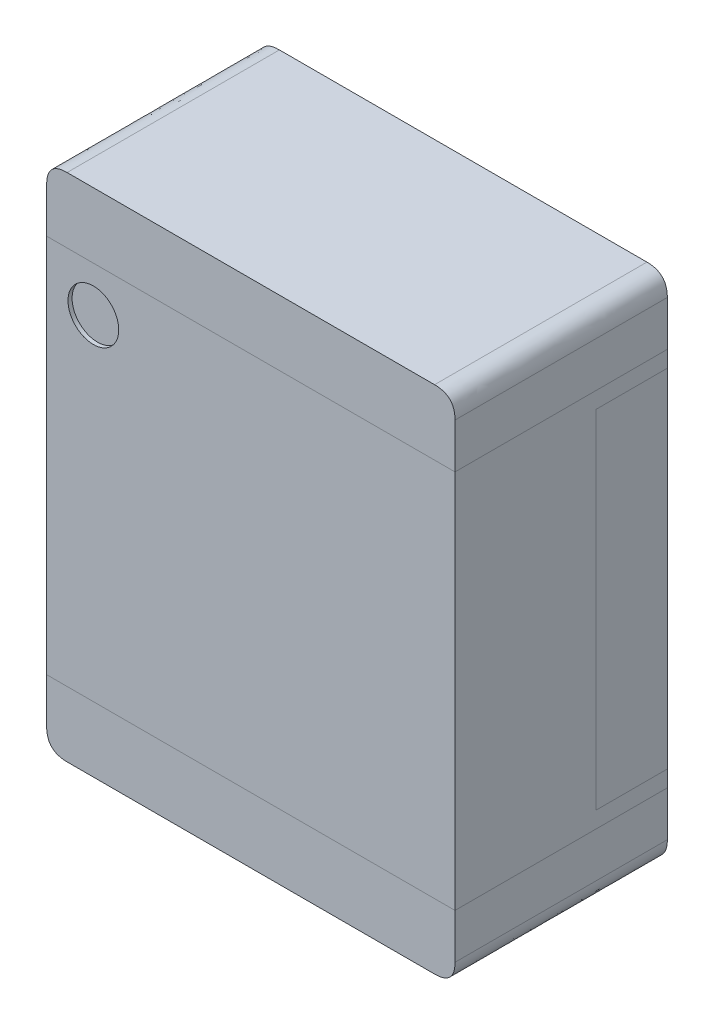
from build123d import *

# Parameters (mm, degrees)
SKETCH1_W             = 2
SKETCH1_H             = 1.86
BOSS_EXTRUDE1_DEPTH   = 1.04
SKETCH8_W             = 2
SKETCH8_H             = 1.04
BOSS_EXTRUDE3_DEPTH   = 0.32
SKETCH10_W            = 2
SKETCH10_H            = 1.04
BOSS_EXTRUDE4_DEPTH   = 0.32
FILLET1_SIZE          = 0.1
FILLET2_SIZE          = 0.1
SKETCH11_W            = 2
SKETCH11_H            = 1.7
CUT_EXTRUDE1_DEPTH    = 0.35
SKETCH11_2_W          = 2
SKETCH11_2_H          = 1.7
BOSS_EXTRUDE5_DEPTH   = 0.35
SKETCH13_W            = 0.2
SKETCH13_H            = 0.3
BOSS_EXTRUDE6_DEPTH   = 0.02
BOSS_EXTRUDE6_2_DEPTH = 0.02
BOSS_EXTRUDE6_3_DEPTH = 0.02
BOSS_EXTRUDE6_4_DEPTH = 0.02
BOSS_EXTRUDE6_5_DEPTH = 0.02
BOSS_EXTRUDE6_6_DEPTH = 0.02
BOSS_EXTRUDE6_7_DEPTH = 0.02
SKETCH14_R            = 0.124288499
CUT_EXTRUDE2_DEPTH    = 0.02


with BuildPart() as part:
    # Sketch1 → Boss-Extrude1 (new body)
    with BuildSketch(Plane.XY):
        Rectangle(SKETCH1_W, SKETCH1_H)
    extrude(amount=BOSS_EXTRUDE1_DEPTH)

    # Sketch11 → Cut-Extrude1 (cut)
    with BuildSketch(Plane.XY):
        Rectangle(SKETCH11_W, SKETCH11_H)
    extrude(amount=CUT_EXTRUDE1_DEPTH, mode=Mode.SUBTRACT)

    # Sketch14 → Cut-Extrude2 (cut)
    with BuildSketch(Plane.XY.offset(1.04)):
        with Locations((-0.771241568, 0.709092923)):
            Circle(SKETCH14_R)
    extrude(amount=-CUT_EXTRUDE2_DEPTH, mode=Mode.SUBTRACT)


with BuildPart() as body_2:
    # Sketch8 → Boss-Extrude3 (new body)
    with BuildSketch(Plane(origin=(0, 0.93, 0), x_dir=(1, 0, 0), z_dir=(0, 1, 0))):
        with Locations((0, -0.52)):
            Rectangle(SKETCH8_W, SKETCH8_H)
    extrude(amount=BOSS_EXTRUDE3_DEPTH)

    # Fillet1
    # a fillet whose section is not a circle: 0.1 mm, written as the material it takes off along each edge
    with BuildSketch(Plane(origin=(1, 1.25, 1.29), x_dir=(0, -1, 0), z_dir=(0, 0, -1)), Plane(origin=(-1, 1.25, -0.25), x_dir=(0, -1, 0), z_dir=(0, 0, 1))) as fillet1_piece_1:
        with BuildLine():
            Bezier((FILLET1_SIZE, 0), (0, 0), (0, FILLET1_SIZE), weights=[1, 1, 1])
            Line((0, FILLET1_SIZE), (0, 0))
            Line((0, 0), (FILLET1_SIZE, 0))
        make_face()
    extrude(amount=1.54, mode=Mode.SUBTRACT)


with BuildPart() as body_3:
    # Sketch10 → Boss-Extrude4 (new body)
    with BuildSketch(Plane(origin=(0, -0.93, 0), x_dir=(-1, 0, 0), z_dir=(0, -1, 0))):
        with Locations((0, -0.52)):
            Rectangle(SKETCH10_W, SKETCH10_H)
    extrude(amount=BOSS_EXTRUDE4_DEPTH)

    # Fillet2
    # a fillet whose section is not a circle: 0.1 mm, written as the material it takes off along each edge
    with BuildSketch(Plane(origin=(1, -1.25, -0.25), x_dir=(0, 1, 0), z_dir=(0, 0, 1)), Plane(origin=(-1, -1.25, 1.29), x_dir=(0, 1, 0), z_dir=(0, 0, -1))) as fillet2_piece_1:
        with BuildLine():
            Bezier((FILLET2_SIZE, 0), (0, 0), (0, FILLET2_SIZE), weights=[1, 1, 1])
            Line((0, FILLET2_SIZE), (0, 0))
            Line((0, 0), (FILLET2_SIZE, 0))
        make_face()
    extrude(amount=1.54, mode=Mode.SUBTRACT)


with BuildPart() as body_4:
    # Sketch11<2> → Boss-Extrude5 (new body)
    with BuildSketch(Plane.XY):
        Rectangle(SKETCH11_2_W, SKETCH11_2_H)
    extrude(amount=BOSS_EXTRUDE5_DEPTH)


with BuildPart() as body_5:
    # Sketch13 → Boss-Extrude6 (new body)
    with BuildSketch(Plane(origin=(0, 0, 0), x_dir=(-1, 0, 0), z_dir=(0, 0, -1))):
        with Locations((-0.85, 0)):
            Rectangle(SKETCH13_W, SKETCH13_H)
    extrude(amount=BOSS_EXTRUDE6_DEPTH)


with BuildPart() as body_6:
    # Sketch13 → Boss-Extrude6 2 (new body)
    with BuildSketch(Plane(origin=(0, 0, 0), x_dir=(-1, 0, 0), z_dir=(0, 0, -1))):
        Polygon((-0.55, 0.75), (0.419840261, 0.75), (0.55, 0.619840261), (0.55, -0.75), (-0.55, -0.75), align=None)
    extrude(amount=BOSS_EXTRUDE6_2_DEPTH)


with BuildPart() as body_7:
    # Sketch13 → Boss-Extrude6 3 (new body)
    with BuildSketch(Plane(origin=(0, 0, 0), x_dir=(-1, 0, 0), z_dir=(0, 0, -1))):
        with Locations((0.85, 0)):
            Rectangle(SKETCH13_W, SKETCH13_H)
    extrude(amount=BOSS_EXTRUDE6_3_DEPTH)


with BuildPart() as body_8:
    # Sketch13 → Boss-Extrude6 4 (new body)
    with BuildSketch(Plane(origin=(0, 0, 0), x_dir=(-1, 0, 0), z_dir=(0, 0, -1))):
        with Locations((0.85, 0.55)):
            Rectangle(SKETCH13_W, SKETCH13_H)
    extrude(amount=BOSS_EXTRUDE6_4_DEPTH)


with BuildPart() as body_9:
    # Sketch13 → Boss-Extrude6 5 (new body)
    with BuildSketch(Plane(origin=(0, 0, 0), x_dir=(-1, 0, 0), z_dir=(0, 0, -1))):
        with Locations((-0.85, 0.55)):
            Rectangle(SKETCH13_W, SKETCH13_H)
    extrude(amount=BOSS_EXTRUDE6_5_DEPTH)


with BuildPart() as body_10:
    # Sketch13 → Boss-Extrude6 6 (new body)
    with BuildSketch(Plane(origin=(0, 0, 0), x_dir=(-1, 0, 0), z_dir=(0, 0, -1))):
        with Locations((0.85, -0.55)):
            Rectangle(SKETCH13_W, SKETCH13_H)
    extrude(amount=BOSS_EXTRUDE6_6_DEPTH)


with BuildPart() as body_11:
    # Sketch13 → Boss-Extrude6 7 (new body)
    with BuildSketch(Plane(origin=(0, 0, 0), x_dir=(-1, 0, 0), z_dir=(0, 0, -1))):
        with Locations((-0.85, -0.55)):
            Rectangle(SKETCH13_W, SKETCH13_H)
    extrude(amount=BOSS_EXTRUDE6_7_DEPTH)


solid = Compound([part.part, body_2.part, body_3.part, body_4.part, body_5.part, body_6.part, body_7.part, body_8.part, body_9.part, body_10.part, body_11.part])
